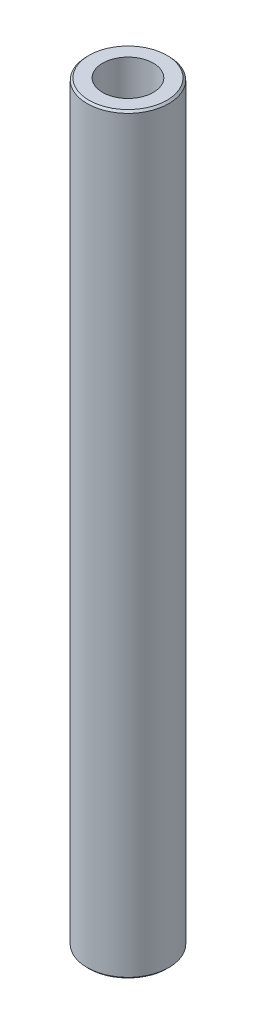
from build123d import *

# Parameters (mm, degrees)
SKETCH1_R           = 12.5
BOSS_EXTRUDE1_DEPTH = 230.034893811
SKETCH2_R           = 7.759335284
CUT_EXTRUDE1_DEPTH  = 231.713138704
CHAMFER1_SIZE       = 0.590385222


with BuildPart() as part:
    # Sketch1 → Boss-Extrude1 (new body)
    with BuildSketch(Plane(origin=(0, 0, 0), x_dir=(1, 0, 0), z_dir=(0, 1, 0))):
        Circle(SKETCH1_R)
    extrude(amount=BOSS_EXTRUDE1_DEPTH)

    # Sketch2 → Cut-Extrude1 (cut, through all)
    with BuildSketch(Plane(origin=(0, 0, 0), x_dir=(1, 0, 0), z_dir=(0, 1, 0))):
        Circle(SKETCH2_R)
    extrude(amount=CUT_EXTRUDE1_DEPTH, mode=Mode.SUBTRACT)

    # Chamfer1
    chamfer1_edges = [part.edges().sort_by_distance(p)[0] for p in [
        (-12.5, 230.034893811, 0),
        (-12.5, 0, 0),
    ]]
    chamfer(chamfer1_edges, length=CHAMFER1_SIZE)


solid = part.part
